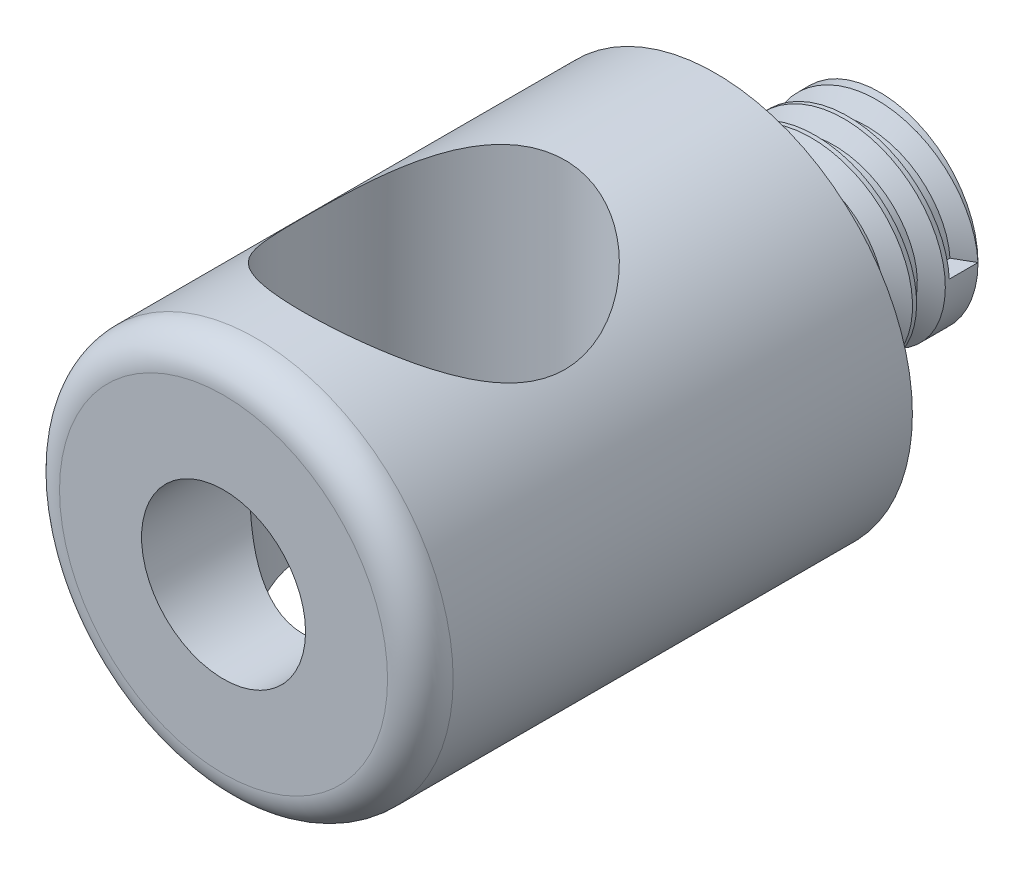
from build123d import *

# Parameters (mm, degrees)
CROQUIS1_R                 = 6
SALIENTE_EXTRUIR1_DEPTH    = 15
CROQUIS2_R                 = 4
CORTAR_EXTRUIR1_DEPTH      = 7.5
CROQUIS3_R                 = 3
SALIENTE_EXTRUIR2_DEPTH    = 5
CORTAR_EXTRUIR2_REACH      = 23.726
CORTAR_EXTRUIR2_END_RADIUS = 4
CROQUIS4_R                 = 2.5
REDONDEO1_R                = 1
ROSCA1_PITCH               = 1


with BuildPart() as part:
    # Croquis1 → Saliente-Extruir1 (new body)
    with BuildSketch(Plane.XY):
        Circle(CROQUIS1_R)
    extrude(amount=SALIENTE_EXTRUIR1_DEPTH)

    # Croquis2 → Cortar-Extruir1 (cut, symmetric)
    with BuildSketch(Plane(origin=(0, 0, 0), x_dir=(1, 0, 0), z_dir=(0, 1, 0))):
        with Locations(Location((0, -8.59, 0), (0, 0, 270))):
            Circle(CROQUIS2_R)
    extrude(amount=CORTAR_EXTRUIR1_DEPTH, both=True, mode=Mode.SUBTRACT)

    # Croquis3 → Saliente-Extruir2 (add)
    with BuildSketch(Plane(origin=(0, 0, 0), x_dir=(-1, 0, 0), z_dir=(0, 0, -1))):
        Circle(CROQUIS3_R)
    extrude(amount=SALIENTE_EXTRUIR2_DEPTH)

    # Cortar-Extruir2: up to this cylinder (the profile starts outside it)
    cortar_extruir2_end = Plane(origin=(0, 0, 8.59), z_dir=(0, 1, 0)) * Cylinder(CORTAR_EXTRUIR2_END_RADIUS, 56.452, mode=Mode.PRIVATE)
    # Croquis4 → Cortar-Extruir2 (cut, up to the surface)
    with BuildSketch(Plane.XY.offset(15), mode=Mode.PRIVATE) as cortar_extruir2_sk1:
        Circle(CROQUIS4_R)
    cortar_extruir2_tool1 = extrude(cortar_extruir2_sk1.sketch, amount=-CORTAR_EXTRUIR2_REACH, mode=Mode.PRIVATE) - cortar_extruir2_end
    add(cortar_extruir2_tool1.solids().sort_by_distance((0, 0, 15))[0], mode=Mode.SUBTRACT)

    # Redondeo1
    redondeo1_edges = [part.edges().sort_by_distance(p)[0] for p in [
        (-6, 0, 15),
    ]]
    fillet(redondeo1_edges, radius=REDONDEO1_R)

    # Rosca1: the profile of Perfil de rosca1 profile screwed along a right-hand helix of 5 turns, 8 arcs to a turn; built about Z, then put on its axis
    rosca1_z = Axis((0, 0, 0), (0, 0, 1))
    rosca1_corners = [(3.0003, 0, -0.000173205), (3.0003, 0, 0.875173202), (2.458734125, 0, 0.562499999), (2.458734125, 0, 0.312499999)]
    with BuildLine(mode=Mode.PRIVATE) as rosca1_profile:
        Line(rosca1_corners[0], rosca1_corners[1])
        Line(rosca1_corners[1], rosca1_corners[2])
        Line(rosca1_corners[2], rosca1_corners[3])
        Line(rosca1_corners[3], rosca1_corners[0])
    rosca1_cap = Face(rosca1_profile.wire())
    rosca1_turn_angles = [0, 22.5, 45, 67.5, 90, 112.5, 135, 157.5, 180, 202.5, 225, 247.5, 270, 292.5, 315, 337.5, 360]
    rosca1_turn_weights = [1, 0.9238795325112867, 1, 0.9238795325112867, 1, 0.9238795325112867, 1, 0.9238795325112867, 1, 0.9238795325112867, 1, 0.9238795325112867, 1, 0.9238795325112867, 1, 0.9238795325112867, 1]
    rosca1_turn_rails = [Edge.make_bspline([Vector(p[0], p[1], 0).rotate(rosca1_z, rosca1_turn_angles[k]) / rosca1_turn_weights[k] + Vector(0, 0, p[2] + ROSCA1_PITCH * rosca1_turn_angles[k] / 360) for k in range(17)], [0, 0, 0, 1, 1, 2, 2, 3, 3, 4, 4, 5, 5, 6, 6, 7, 7, 8, 8, 8], 2, rosca1_turn_weights) for p in rosca1_corners]
    rosca1_turn_sides = [Face.make_surface_from_curves(rosca1_turn_rails[p[0]], rosca1_turn_rails[p[1]]) for p in [(0, 1), (1, 2), (2, 3), (3, 0)]]
    rosca1 = Plane(origin=(0, 0, -5), x_dir=(1, 0, 0), z_dir=(0, 0, 1)) * Solid(Shell([*[p.moved(Location((0, 0, ROSCA1_PITCH * i))) for i in range(5) for p in rosca1_turn_sides], rosca1_cap, rosca1_cap.rotate(rosca1_z, 1800).moved(Location((0, 0, ROSCA1_PITCH * 1800 / 360)))]))
    add(rosca1, mode=Mode.SUBTRACT)


solid = part.part
